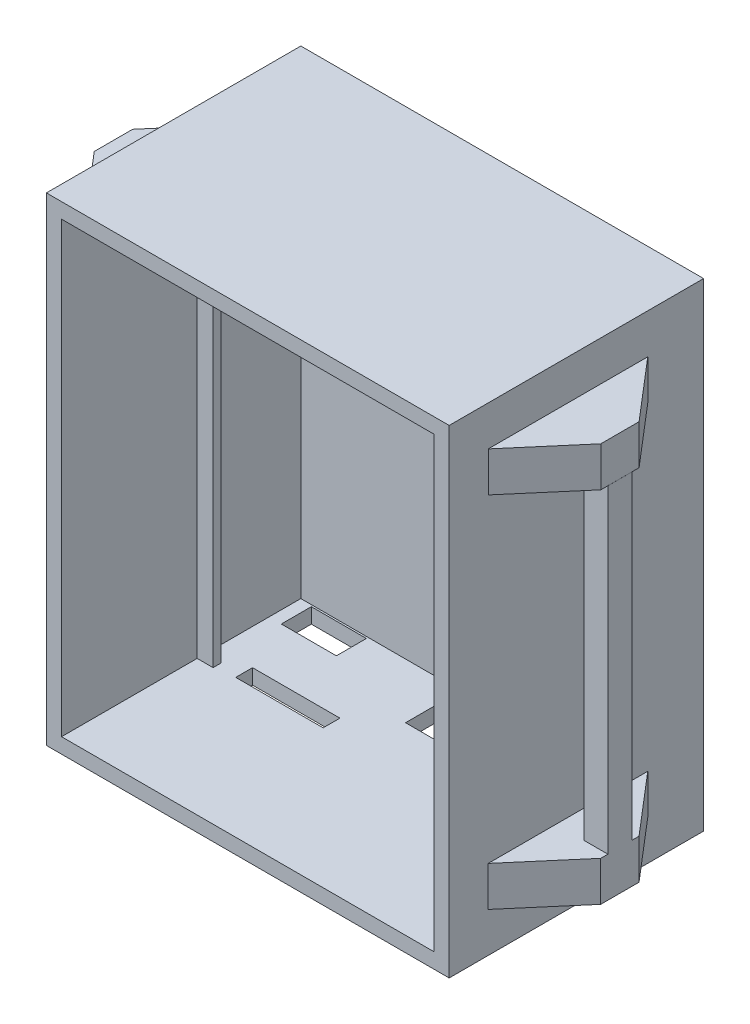
from build123d import *

# Parameters (mm, degrees)
SCHIZZO1_W                    = 50.5
SCHIZZO1_H                    = 60
ESTRUSIONE_ESTRUSIONE1_DEPTH  = 1.9
SCHIZZO2_W                    = 1.9
SCHIZZO2_H                    = 60
ESTRUSIONE_ESTRUSIONE2_DEPTH  = 30
SCHIZZO3_W                    = 48.6
SCHIZZO3_H                    = 1.9
ESTRUSIONE_ESTRUSIONE3_DEPTH  = 30
SCHIZZO4_W                    = 1.9
SCHIZZO4_H                    = 58.1
ESTRUSIONE_ESTRUSIONE4_DEPTH  = 30
SCHIZZO5_W                    = 46.7
SCHIZZO5_H                    = 1.9
ESTRUSIONE_ESTRUSIONE5_DEPTH  = 30
SCHIZZO6_W                    = 4.6
SCHIZZO6_H                    = 39.07690979
ESTRUSIONE_ESTRUSIONE6_DEPTH  = 13
SCHIZZO7_W                    = 23.476572129
SCHIZZO7_H                    = 4.659918653
ESTRUSIONE_ESTRUSIONE7_DEPTH  = 13
SCHIZZO8_W                    = 1
SCHIZZO8_H                    = 42.069064227
ESTRUSIONE_ESTRUSIONE8_DEPTH  = 2
SCHIZZO9_W                    = 1.5
SCHIZZO9_H                    = 17.12309021
ESTRUSIONE_ESTRUSIONE9_DEPTH  = 4
SCHIZZO10_W                   = 1.5
SCHIZZO10_H                   = 9.47101712
ESTRUSIONE_ESTRUSIONE10_DEPTH = 4
SCHIZZO11_W                   = 6.905155868
SCHIZZO11_H                   = 3.764387107
TAGLIO_ESTRUSIONE1_DEPTH      = 2
SCHIZZO13_W                   = 15.903630787
SCHIZZO13_H                   = 4.865229634
TAGLIO_ESTRUSIONE2_DEPTH      = 2
SCHIZZO14_W                   = 10.95879518
SCHIZZO14_H                   = 2.106581553
TAGLIO_ESTRUSIONE3_DEPTH      = 2
SCHIZZO15_W                   = 20
SCHIZZO15_H                   = 5
ESTRUSIONE_ESTRUSIONE11_DEPTH = 6.5
SCHIZZO16_W                   = 3
SCHIZZO16_H                   = 3
ESTRUSIONE_ESTRUSIONE12_DEPTH = 40
SCHIZZO17_W                   = 20
SCHIZZO17_H                   = 5
ESTRUSIONE_ESTRUSIONE13_DEPTH = 6.5
TAGLIO_ESTRUSIONE4_DEPTH      = 6.5
TAGLIO_ESTRUSIONE5_DEPTH      = 6.5
TAGLIO_ESTRUSIONE6_DEPTH      = 6.5
TAGLIO_ESTRUSIONE7_DEPTH      = 6.5
SCHIZZO22_W                   = 20.001352525
SCHIZZO22_H                   = 5
ESTRUSIONE_ESTRUSIONE14_DEPTH = 6.5
SCHIZZO23_W                   = 3
SCHIZZO23_H                   = 3
ESTRUSIONE_ESTRUSIONE15_DEPTH = 40
SCHIZZO24_W                   = 20.00326161
SCHIZZO24_H                   = 5
ESTRUSIONE_ESTRUSIONE16_DEPTH = 6.5
TAGLIO_ESTRUSIONE8_DEPTH      = 6.5
TAGLIO_ESTRUSIONE9_DEPTH      = 6.5
TAGLIO_ESTRUSIONE10_DEPTH     = 6.5
TAGLIO_ESTRUSIONE11_DEPTH     = 6.5


with BuildPart() as part:
    # Schizzo1 → Estrusione-Estrusione1 (new body)
    with BuildSketch(Plane.XY):
        with Locations((25.25, 30)):
            Rectangle(SCHIZZO1_W, SCHIZZO1_H)
    extrude(amount=ESTRUSIONE_ESTRUSIONE1_DEPTH)

    # Schizzo2 → Estrusione-Estrusione2 (add)
    with BuildSketch(Plane.XY.offset(1.9)):
        with Locations((0.95, 30)):
            Rectangle(SCHIZZO2_W, SCHIZZO2_H)
    extrude(amount=ESTRUSIONE_ESTRUSIONE2_DEPTH)

    # Schizzo3 → Estrusione-Estrusione3 (add)
    with BuildSketch(Plane.XY.offset(1.9)):
        with Locations((26.2, 0.95)):
            Rectangle(SCHIZZO3_W, SCHIZZO3_H)
    extrude(amount=ESTRUSIONE_ESTRUSIONE3_DEPTH)

    # Schizzo4 → Estrusione-Estrusione4 (add)
    with BuildSketch(Plane.XY.offset(1.9)):
        with Locations((49.55, 30.95)):
            Rectangle(SCHIZZO4_W, SCHIZZO4_H)
    extrude(amount=ESTRUSIONE_ESTRUSIONE4_DEPTH)

    # Schizzo5 → Estrusione-Estrusione5 (add)
    with BuildSketch(Plane.XY.offset(1.9)):
        with Locations((25.25, 59.05)):
            Rectangle(SCHIZZO5_W, SCHIZZO5_H)
    extrude(amount=ESTRUSIONE_ESTRUSIONE5_DEPTH)

    # Schizzo6 → Estrusione-Estrusione6 (add)
    with BuildSketch(Plane.XY.offset(1.9)):
        with Locations((46.3, 21.438454895)):
            Rectangle(SCHIZZO6_W, SCHIZZO6_H)
    extrude(amount=ESTRUSIONE_ESTRUSIONE6_DEPTH)

    # Schizzo7 → Estrusione-Estrusione7 (add)
    with BuildSketch(Plane.XY.offset(1.9)):
        with Locations((13.638286065, 46.299023554)):
            Rectangle(SCHIZZO7_W, SCHIZZO7_H)
    extrude(amount=ESTRUSIONE_ESTRUSIONE7_DEPTH)

    # Schizzo8 → Estrusione-Estrusione8 (add)
    with BuildSketch(Plane(origin=(1.9, 0, 0), x_dir=(0, 0, -1), z_dir=(1, 0, 0))):
        with Locations((-14.4, 22.934532114)):
            Rectangle(SCHIZZO8_W, SCHIZZO8_H)
    extrude(amount=ESTRUSIONE_ESTRUSIONE8_DEPTH)

    # Schizzo9 → Estrusione-Estrusione9 (add)
    with BuildSketch(Plane.ZY.offset(-48.6)):
        with Locations((14.15, 49.538454895)):
            Rectangle(SCHIZZO9_W, SCHIZZO9_H)
    extrude(amount=ESTRUSIONE_ESTRUSIONE9_DEPTH)

    # Schizzo10 → Estrusione-Estrusione10 (add)
    with BuildSketch(Plane(origin=(1.9, 0, 0), x_dir=(0, 0, -1), z_dir=(1, 0, 0))):
        with Locations((-14.15, 53.36449144)):
            Rectangle(SCHIZZO10_W, SCHIZZO10_H)
    extrude(amount=ESTRUSIONE_ESTRUSIONE10_DEPTH)

    # Schizzo11 → Taglio-Estrusione1 (cut)
    with BuildSketch(Plane(origin=(0, 0, 0), x_dir=(-1, 0, 0), z_dir=(0, -1, 0))):
        with Locations((-6.89178475, -4.002985694)):
            Rectangle(SCHIZZO11_W, SCHIZZO11_H)
    extrude(amount=-TAGLIO_ESTRUSIONE1_DEPTH, mode=Mode.SUBTRACT)

    # Schizzo13 → Taglio-Estrusione2 (cut)
    with BuildSketch(Plane(origin=(0, 0, 0), x_dir=(-1, 0, 0), z_dir=(0, -1, 0))):
        with Locations((-29.895255689, -6.384557983)):
            Rectangle(SCHIZZO13_W, SCHIZZO13_H)
    extrude(amount=-TAGLIO_ESTRUSIONE2_DEPTH, mode=Mode.SUBTRACT)

    # Schizzo14 → Taglio-Estrusione3 (cut)
    with BuildSketch(Plane.XZ):
        with Locations((11.855335678, 13.484586242)):
            Rectangle(SCHIZZO14_W, SCHIZZO14_H)
    extrude(amount=-TAGLIO_ESTRUSIONE3_DEPTH, mode=Mode.SUBTRACT)

    # Schizzo15 → Estrusione-Estrusione11 (add)
    with BuildSketch(Plane(origin=(50.5, 0, 0), x_dir=(0, 0, -1), z_dir=(1, 0, 0))):
        with Locations((-17.001462523, 7.495543078)):
            Rectangle(SCHIZZO15_W, SCHIZZO15_H)
    extrude(amount=ESTRUSIONE_ESTRUSIONE11_DEPTH)

    # Schizzo16 → Estrusione-Estrusione12 (add)
    with BuildSketch(Plane(origin=(0, 9.995543078, 0), x_dir=(1, 0, 0), z_dir=(0, 1, 0))):
        with Locations((55.5, -17.002009902)):
            Rectangle(SCHIZZO16_W, SCHIZZO16_H)
    extrude(amount=ESTRUSIONE_ESTRUSIONE12_DEPTH)

    # Schizzo17 → Estrusione-Estrusione13 (add)
    with BuildSketch(Plane(origin=(50.5, 0, 0), x_dir=(0, 0, -1), z_dir=(1, 0, 0))):
        with Locations((-16.998938605, 52.501542019)):
            Rectangle(SCHIZZO17_W, SCHIZZO17_H)
    extrude(amount=ESTRUSIONE_ESTRUSIONE13_DEPTH)

    # Schizzo18 → Taglio-Estrusione4 (cut)
    with BuildSketch(Plane.XZ.offset(-4.995543078)):
        Polygon((57, 27.001462523), (50.5, 27.001462523), (57, 19.396274061), align=None)
    extrude(amount=-TAGLIO_ESTRUSIONE4_DEPTH, mode=Mode.SUBTRACT)

    # Schizzo19 → Taglio-Estrusione5 (cut)
    with BuildSketch(Plane.XZ.offset(-4.995543078)):
        Polygon((57, 7.001462523), (50.5, 7.001462523), (57, 14.597658378), align=None)
    extrude(amount=-TAGLIO_ESTRUSIONE5_DEPTH, mode=Mode.SUBTRACT)

    # Schizzo20 → Taglio-Estrusione6 (cut)
    with BuildSketch(Plane(origin=(0, 55.001542019, 0), x_dir=(1, 0, 0), z_dir=(0, 1, 0))):
        Polygon((57, -26.998938605), (50.5, -26.998938605), (57, -19.389527853), align=None)
    extrude(amount=-TAGLIO_ESTRUSIONE6_DEPTH, mode=Mode.SUBTRACT)

    # Schizzo21 → Taglio-Estrusione7 (cut)
    with BuildSketch(Plane(origin=(0, 55.001542019, 0), x_dir=(1, 0, 0), z_dir=(0, 1, 0))):
        Polygon((57, -6.998938605), (50.5, -6.998938605), (57, -14.591755232), align=None)
    extrude(amount=-TAGLIO_ESTRUSIONE7_DEPTH, mode=Mode.SUBTRACT)

    # Schizzo22 → Estrusione-Estrusione14 (add)
    with BuildSketch(Plane.ZY):
        with Locations((16.995641234, 7.503764192)):
            Rectangle(SCHIZZO22_W, SCHIZZO22_H)
    extrude(amount=ESTRUSIONE_ESTRUSIONE14_DEPTH)

    # Schizzo23 → Estrusione-Estrusione15 (add)
    with BuildSketch(Plane(origin=(0, 10.003764192, 0), x_dir=(1, 0, 0), z_dir=(0, 1, 0))):
        with Locations((-5, -16.99919375)):
            Rectangle(SCHIZZO23_W, SCHIZZO23_H)
    extrude(amount=ESTRUSIONE_ESTRUSIONE15_DEPTH)

    # Schizzo24 → Estrusione-Estrusione16 (add)
    with BuildSketch(Plane.ZY):
        with Locations((17.000546308, 52.500495178)):
            Rectangle(SCHIZZO24_W, SCHIZZO24_H)
    extrude(amount=ESTRUSIONE_ESTRUSIONE16_DEPTH)

    # Schizzo25 → Taglio-Estrusione8 (cut)
    with BuildSketch(Plane(origin=(0, 5.003764192, 0), x_dir=(-1, 0, 0), z_dir=(0, -1, 0))):
        Polygon((6.5, -6.994964971), (0, -6.994964971), (6.5, -14.588932537), align=None)
    extrude(amount=-TAGLIO_ESTRUSIONE8_DEPTH, mode=Mode.SUBTRACT)

    # Schizzo26 → Taglio-Estrusione9 (cut)
    with BuildSketch(Plane(origin=(0, 5.003764192, 0), x_dir=(-1, 0, 0), z_dir=(0, -1, 0))):
        Polygon((6.5, -26.996317496), (0, -26.996317496), (6.5, -19.40143242), align=None)
    extrude(amount=-TAGLIO_ESTRUSIONE9_DEPTH, mode=Mode.SUBTRACT)

    # Schizzo27 → Taglio-Estrusione10 (cut)
    with BuildSketch(Plane(origin=(0, 55.000495178, 0), x_dir=(1, 0, 0), z_dir=(0, 1, 0))):
        Polygon((-6.5, -27.002177113), (0, -27.002177113), (-6.5, -19.40143242), align=None)
    extrude(amount=-TAGLIO_ESTRUSIONE10_DEPTH, mode=Mode.SUBTRACT)

    # Schizzo28 → Taglio-Estrusione11 (cut)
    with BuildSketch(Plane(origin=(0, 55.000495178, 0), x_dir=(1, 0, 0), z_dir=(0, 1, 0))):
        Polygon((-6.5, -6.998915503), (0, -6.998915503), (-6.5, -14.588932537), align=None)
    extrude(amount=-TAGLIO_ESTRUSIONE11_DEPTH, mode=Mode.SUBTRACT)


solid = part.part
